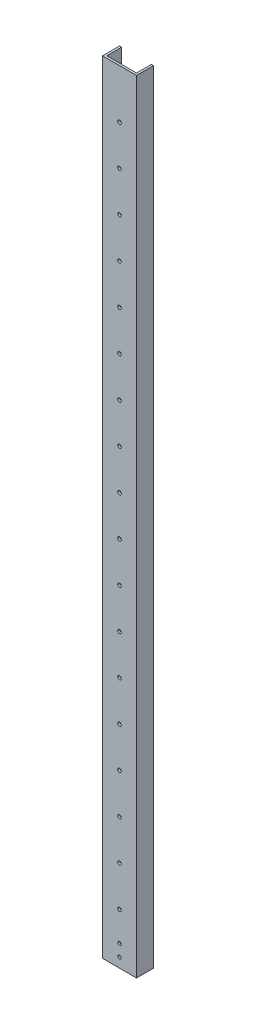
from build123d import *

# Parameters (mm, degrees)
BOSS_EXTRUDE1_DEPTH = 1168.4
CUT_EXTRUDE1_REACH  = 1171.78
SKETCH2_R           = 2.667
CUT_EXTRUDE2_REACH  = 1171.78
SKETCH3_R           = 2.5527
CUT_EXTRUDE3_REACH  = 1171.78
SKETCH4_R           = 2.667


with BuildPart() as part:
    # Sketch1 → Boss-Extrude1 (new body)
    with BuildSketch(Plane(origin=(0, 0, 0), x_dir=(1, 0, 0), z_dir=(0, 1, 0))):
        Polygon((3.175, 3.175), (3.175, 25.4), (0, 25.4), (0, 0), (50.8, 0), (50.8, 25.4), (47.625, 25.4), (47.625, 3.175), align=None)
    extrude(amount=BOSS_EXTRUDE1_DEPTH)

    # Sketch2 → Cut-Extrude1 (cut, up to next)
    with BuildSketch(Plane.XY, mode=Mode.PRIVATE) as cut_extrude1_sk1:
        with Locations((25.4, 76.2)):
            Circle(SKETCH2_R)
    cut_extrude1_tool1 = extrude(cut_extrude1_sk1.sketch, amount=-CUT_EXTRUDE1_REACH, mode=Mode.PRIVATE) & part.part
    # Sketch2 → Cut-Extrude1 (cut, up to next)
    with BuildSketch(Plane.XY, mode=Mode.PRIVATE) as cut_extrude1_sk2:
        with Locations((25.4, 136.144)):
            Circle(SKETCH2_R)
    cut_extrude1_tool2 = extrude(cut_extrude1_sk2.sketch, amount=-CUT_EXTRUDE1_REACH, mode=Mode.PRIVATE) & part.part
    # Sketch2 → Cut-Extrude1 (cut, up to next)
    with BuildSketch(Plane.XY, mode=Mode.PRIVATE) as cut_extrude1_sk3:
        with Locations((25.4, 196.088)):
            Circle(SKETCH2_R)
    cut_extrude1_tool3 = extrude(cut_extrude1_sk3.sketch, amount=-CUT_EXTRUDE1_REACH, mode=Mode.PRIVATE) & part.part
    # Sketch2 → Cut-Extrude1 (cut, up to next)
    with BuildSketch(Plane.XY, mode=Mode.PRIVATE) as cut_extrude1_sk4:
        with Locations((25.4, 256.032)):
            Circle(SKETCH2_R)
    cut_extrude1_tool4 = extrude(cut_extrude1_sk4.sketch, amount=-CUT_EXTRUDE1_REACH, mode=Mode.PRIVATE) & part.part
    # Sketch2 → Cut-Extrude1 (cut, up to next)
    with BuildSketch(Plane.XY, mode=Mode.PRIVATE) as cut_extrude1_sk5:
        with Locations((25.4, 315.976)):
            Circle(SKETCH2_R)
    cut_extrude1_tool5 = extrude(cut_extrude1_sk5.sketch, amount=-CUT_EXTRUDE1_REACH, mode=Mode.PRIVATE) & part.part
    # Sketch2 → Cut-Extrude1 (cut, up to next)
    with BuildSketch(Plane.XY, mode=Mode.PRIVATE) as cut_extrude1_sk6:
        with Locations((25.4, 375.92)):
            Circle(SKETCH2_R)
    cut_extrude1_tool6 = extrude(cut_extrude1_sk6.sketch, amount=-CUT_EXTRUDE1_REACH, mode=Mode.PRIVATE) & part.part
    # Sketch2 → Cut-Extrude1 (cut, up to next)
    with BuildSketch(Plane.XY, mode=Mode.PRIVATE) as cut_extrude1_sk7:
        with Locations((25.4, 435.864)):
            Circle(SKETCH2_R)
    cut_extrude1_tool7 = extrude(cut_extrude1_sk7.sketch, amount=-CUT_EXTRUDE1_REACH, mode=Mode.PRIVATE) & part.part
    # Sketch2 → Cut-Extrude1 (cut, up to next)
    with BuildSketch(Plane.XY, mode=Mode.PRIVATE) as cut_extrude1_sk8:
        with Locations((25.4, 495.808)):
            Circle(SKETCH2_R)
    cut_extrude1_tool8 = extrude(cut_extrude1_sk8.sketch, amount=-CUT_EXTRUDE1_REACH, mode=Mode.PRIVATE) & part.part
    # Sketch2 → Cut-Extrude1 (cut, up to next)
    with BuildSketch(Plane.XY, mode=Mode.PRIVATE) as cut_extrude1_sk9:
        with Locations((25.4, 555.752)):
            Circle(SKETCH2_R)
    cut_extrude1_tool9 = extrude(cut_extrude1_sk9.sketch, amount=-CUT_EXTRUDE1_REACH, mode=Mode.PRIVATE) & part.part
    # Sketch2 → Cut-Extrude1 (cut, up to next)
    with BuildSketch(Plane.XY, mode=Mode.PRIVATE) as cut_extrude1_sk10:
        with Locations((25.4, 615.696)):
            Circle(SKETCH2_R)
    cut_extrude1_tool10 = extrude(cut_extrude1_sk10.sketch, amount=-CUT_EXTRUDE1_REACH, mode=Mode.PRIVATE) & part.part
    # Sketch2 → Cut-Extrude1 (cut, up to next)
    with BuildSketch(Plane.XY, mode=Mode.PRIVATE) as cut_extrude1_sk11:
        with Locations((25.4, 675.64)):
            Circle(SKETCH2_R)
    cut_extrude1_tool11 = extrude(cut_extrude1_sk11.sketch, amount=-CUT_EXTRUDE1_REACH, mode=Mode.PRIVATE) & part.part
    # Sketch2 → Cut-Extrude1 (cut, up to next)
    with BuildSketch(Plane.XY, mode=Mode.PRIVATE) as cut_extrude1_sk12:
        with Locations((25.4, 735.584)):
            Circle(SKETCH2_R)
    cut_extrude1_tool12 = extrude(cut_extrude1_sk12.sketch, amount=-CUT_EXTRUDE1_REACH, mode=Mode.PRIVATE) & part.part
    # Sketch2 → Cut-Extrude1 (cut, up to next)
    with BuildSketch(Plane.XY, mode=Mode.PRIVATE) as cut_extrude1_sk13:
        with Locations((25.4, 795.528)):
            Circle(SKETCH2_R)
    cut_extrude1_tool13 = extrude(cut_extrude1_sk13.sketch, amount=-CUT_EXTRUDE1_REACH, mode=Mode.PRIVATE) & part.part
    # Sketch2 → Cut-Extrude1 (cut, up to next)
    with BuildSketch(Plane.XY, mode=Mode.PRIVATE) as cut_extrude1_sk14:
        with Locations((25.4, 855.472)):
            Circle(SKETCH2_R)
    cut_extrude1_tool14 = extrude(cut_extrude1_sk14.sketch, amount=-CUT_EXTRUDE1_REACH, mode=Mode.PRIVATE) & part.part
    # Sketch2 → Cut-Extrude1 (cut, up to next)
    with BuildSketch(Plane.XY, mode=Mode.PRIVATE) as cut_extrude1_sk15:
        with Locations((25.4, 915.416)):
            Circle(SKETCH2_R)
    cut_extrude1_tool15 = extrude(cut_extrude1_sk15.sketch, amount=-CUT_EXTRUDE1_REACH, mode=Mode.PRIVATE) & part.part
    # Sketch2 → Cut-Extrude1 (cut, up to next)
    with BuildSketch(Plane.XY, mode=Mode.PRIVATE) as cut_extrude1_sk16:
        with Locations((25.4, 975.36)):
            Circle(SKETCH2_R)
    cut_extrude1_tool16 = extrude(cut_extrude1_sk16.sketch, amount=-CUT_EXTRUDE1_REACH, mode=Mode.PRIVATE) & part.part
    # Sketch2 → Cut-Extrude1 (cut, up to next)
    with BuildSketch(Plane.XY, mode=Mode.PRIVATE) as cut_extrude1_sk17:
        with Locations((25.4, 1035.304)):
            Circle(SKETCH2_R)
    cut_extrude1_tool17 = extrude(cut_extrude1_sk17.sketch, amount=-CUT_EXTRUDE1_REACH, mode=Mode.PRIVATE) & part.part
    # Sketch2 → Cut-Extrude1 (cut, up to next)
    with BuildSketch(Plane.XY, mode=Mode.PRIVATE) as cut_extrude1_sk18:
        with Locations((25.4, 1095.248)):
            Circle(SKETCH2_R)
    cut_extrude1_tool18 = extrude(cut_extrude1_sk18.sketch, amount=-CUT_EXTRUDE1_REACH, mode=Mode.PRIVATE) & part.part
    add(cut_extrude1_tool1.solids().sort_by_distance((25.4, 76.2, 0))[0], mode=Mode.SUBTRACT)
    add(cut_extrude1_tool2.solids().sort_by_distance((25.4, 136.144, 0))[0], mode=Mode.SUBTRACT)
    add(cut_extrude1_tool3.solids().sort_by_distance((25.4, 196.088, 0))[0], mode=Mode.SUBTRACT)
    add(cut_extrude1_tool4.solids().sort_by_distance((25.4, 256.032, 0))[0], mode=Mode.SUBTRACT)
    add(cut_extrude1_tool5.solids().sort_by_distance((25.4, 315.976, 0))[0], mode=Mode.SUBTRACT)
    add(cut_extrude1_tool6.solids().sort_by_distance((25.4, 375.92, 0))[0], mode=Mode.SUBTRACT)
    add(cut_extrude1_tool7.solids().sort_by_distance((25.4, 435.864, 0))[0], mode=Mode.SUBTRACT)
    add(cut_extrude1_tool8.solids().sort_by_distance((25.4, 495.808, 0))[0], mode=Mode.SUBTRACT)
    add(cut_extrude1_tool9.solids().sort_by_distance((25.4, 555.752, 0))[0], mode=Mode.SUBTRACT)
    add(cut_extrude1_tool10.solids().sort_by_distance((25.4, 615.696, 0))[0], mode=Mode.SUBTRACT)
    add(cut_extrude1_tool11.solids().sort_by_distance((25.4, 675.64, 0))[0], mode=Mode.SUBTRACT)
    add(cut_extrude1_tool12.solids().sort_by_distance((25.4, 735.584, 0))[0], mode=Mode.SUBTRACT)
    add(cut_extrude1_tool13.solids().sort_by_distance((25.4, 795.528, 0))[0], mode=Mode.SUBTRACT)
    add(cut_extrude1_tool14.solids().sort_by_distance((25.4, 855.472, 0))[0], mode=Mode.SUBTRACT)
    add(cut_extrude1_tool15.solids().sort_by_distance((25.4, 915.416, 0))[0], mode=Mode.SUBTRACT)
    add(cut_extrude1_tool16.solids().sort_by_distance((25.4, 975.36, 0))[0], mode=Mode.SUBTRACT)
    add(cut_extrude1_tool17.solids().sort_by_distance((25.4, 1035.304, 0))[0], mode=Mode.SUBTRACT)
    add(cut_extrude1_tool18.solids().sort_by_distance((25.4, 1095.248, 0))[0], mode=Mode.SUBTRACT)

    # Sketch3 → Cut-Extrude2 (cut, up to next)
    with BuildSketch(Plane.XY, mode=Mode.PRIVATE) as cut_extrude2_sk1:
        with Locations((25.4, 32.131)):
            Circle(SKETCH3_R)
    cut_extrude2_tool1 = extrude(cut_extrude2_sk1.sketch, amount=-CUT_EXTRUDE2_REACH, mode=Mode.PRIVATE) & part.part
    # Sketch3 → Cut-Extrude2 (cut, up to next)
    with BuildSketch(Plane.XY, mode=Mode.PRIVATE) as cut_extrude2_sk2:
        with Locations((25.4, 14.2875)):
            Circle(SKETCH3_R)
    cut_extrude2_tool2 = extrude(cut_extrude2_sk2.sketch, amount=-CUT_EXTRUDE2_REACH, mode=Mode.PRIVATE) & part.part
    add(cut_extrude2_tool1.solids().sort_by_distance((25.4, 32.131, 0))[0], mode=Mode.SUBTRACT)
    add(cut_extrude2_tool2.solids().sort_by_distance((25.4, 14.2875, 0))[0], mode=Mode.SUBTRACT)

    # Sketch4 → Cut-Extrude3 (cut, up to next)
    with BuildSketch(Plane.ZY, mode=Mode.PRIVATE) as cut_extrude3_sk1:
        with Locations((-19.05, 76.2)):
            Circle(SKETCH4_R)
    cut_extrude3_tool1 = extrude(cut_extrude3_sk1.sketch, amount=-CUT_EXTRUDE3_REACH, mode=Mode.PRIVATE) & part.part
    # Sketch4 → Cut-Extrude3 (cut, up to next)
    with BuildSketch(Plane.ZY, mode=Mode.PRIVATE) as cut_extrude3_sk2:
        with Locations((-19.05, 136.144)):
            Circle(SKETCH4_R)
    cut_extrude3_tool2 = extrude(cut_extrude3_sk2.sketch, amount=-CUT_EXTRUDE3_REACH, mode=Mode.PRIVATE) & part.part
    # Sketch4 → Cut-Extrude3 (cut, up to next)
    with BuildSketch(Plane.ZY, mode=Mode.PRIVATE) as cut_extrude3_sk3:
        with Locations((-19.05, 196.088)):
            Circle(SKETCH4_R)
    cut_extrude3_tool3 = extrude(cut_extrude3_sk3.sketch, amount=-CUT_EXTRUDE3_REACH, mode=Mode.PRIVATE) & part.part
    # Sketch4 → Cut-Extrude3 (cut, up to next)
    with BuildSketch(Plane.ZY, mode=Mode.PRIVATE) as cut_extrude3_sk4:
        with Locations((-19.05, 256.032)):
            Circle(SKETCH4_R)
    cut_extrude3_tool4 = extrude(cut_extrude3_sk4.sketch, amount=-CUT_EXTRUDE3_REACH, mode=Mode.PRIVATE) & part.part
    # Sketch4 → Cut-Extrude3 (cut, up to next)
    with BuildSketch(Plane.ZY, mode=Mode.PRIVATE) as cut_extrude3_sk5:
        with Locations((-19.05, 315.976)):
            Circle(SKETCH4_R)
    cut_extrude3_tool5 = extrude(cut_extrude3_sk5.sketch, amount=-CUT_EXTRUDE3_REACH, mode=Mode.PRIVATE) & part.part
    # Sketch4 → Cut-Extrude3 (cut, up to next)
    with BuildSketch(Plane.ZY, mode=Mode.PRIVATE) as cut_extrude3_sk6:
        with Locations((-19.05, 375.92)):
            Circle(SKETCH4_R)
    cut_extrude3_tool6 = extrude(cut_extrude3_sk6.sketch, amount=-CUT_EXTRUDE3_REACH, mode=Mode.PRIVATE) & part.part
    # Sketch4 → Cut-Extrude3 (cut, up to next)
    with BuildSketch(Plane.ZY, mode=Mode.PRIVATE) as cut_extrude3_sk7:
        with Locations((-19.05, 435.864)):
            Circle(SKETCH4_R)
    cut_extrude3_tool7 = extrude(cut_extrude3_sk7.sketch, amount=-CUT_EXTRUDE3_REACH, mode=Mode.PRIVATE) & part.part
    # Sketch4 → Cut-Extrude3 (cut, up to next)
    with BuildSketch(Plane.ZY, mode=Mode.PRIVATE) as cut_extrude3_sk8:
        with Locations((-19.05, 495.808)):
            Circle(SKETCH4_R)
    cut_extrude3_tool8 = extrude(cut_extrude3_sk8.sketch, amount=-CUT_EXTRUDE3_REACH, mode=Mode.PRIVATE) & part.part
    # Sketch4 → Cut-Extrude3 (cut, up to next)
    with BuildSketch(Plane.ZY, mode=Mode.PRIVATE) as cut_extrude3_sk9:
        with Locations((-19.05, 555.752)):
            Circle(SKETCH4_R)
    cut_extrude3_tool9 = extrude(cut_extrude3_sk9.sketch, amount=-CUT_EXTRUDE3_REACH, mode=Mode.PRIVATE) & part.part
    # Sketch4 → Cut-Extrude3 (cut, up to next)
    with BuildSketch(Plane.ZY, mode=Mode.PRIVATE) as cut_extrude3_sk10:
        with Locations((-19.05, 615.696)):
            Circle(SKETCH4_R)
    cut_extrude3_tool10 = extrude(cut_extrude3_sk10.sketch, amount=-CUT_EXTRUDE3_REACH, mode=Mode.PRIVATE) & part.part
    # Sketch4 → Cut-Extrude3 (cut, up to next)
    with BuildSketch(Plane.ZY, mode=Mode.PRIVATE) as cut_extrude3_sk11:
        with Locations((-19.05, 675.64)):
            Circle(SKETCH4_R)
    cut_extrude3_tool11 = extrude(cut_extrude3_sk11.sketch, amount=-CUT_EXTRUDE3_REACH, mode=Mode.PRIVATE) & part.part
    # Sketch4 → Cut-Extrude3 (cut, up to next)
    with BuildSketch(Plane.ZY, mode=Mode.PRIVATE) as cut_extrude3_sk12:
        with Locations((-19.05, 735.584)):
            Circle(SKETCH4_R)
    cut_extrude3_tool12 = extrude(cut_extrude3_sk12.sketch, amount=-CUT_EXTRUDE3_REACH, mode=Mode.PRIVATE) & part.part
    # Sketch4 → Cut-Extrude3 (cut, up to next)
    with BuildSketch(Plane.ZY, mode=Mode.PRIVATE) as cut_extrude3_sk13:
        with Locations((-19.05, 795.528)):
            Circle(SKETCH4_R)
    cut_extrude3_tool13 = extrude(cut_extrude3_sk13.sketch, amount=-CUT_EXTRUDE3_REACH, mode=Mode.PRIVATE) & part.part
    # Sketch4 → Cut-Extrude3 (cut, up to next)
    with BuildSketch(Plane.ZY, mode=Mode.PRIVATE) as cut_extrude3_sk14:
        with Locations((-19.05, 855.472)):
            Circle(SKETCH4_R)
    cut_extrude3_tool14 = extrude(cut_extrude3_sk14.sketch, amount=-CUT_EXTRUDE3_REACH, mode=Mode.PRIVATE) & part.part
    # Sketch4 → Cut-Extrude3 (cut, up to next)
    with BuildSketch(Plane.ZY, mode=Mode.PRIVATE) as cut_extrude3_sk15:
        with Locations((-19.05, 915.416)):
            Circle(SKETCH4_R)
    cut_extrude3_tool15 = extrude(cut_extrude3_sk15.sketch, amount=-CUT_EXTRUDE3_REACH, mode=Mode.PRIVATE) & part.part
    # Sketch4 → Cut-Extrude3 (cut, up to next)
    with BuildSketch(Plane.ZY, mode=Mode.PRIVATE) as cut_extrude3_sk16:
        with Locations((-19.05, 975.36)):
            Circle(SKETCH4_R)
    cut_extrude3_tool16 = extrude(cut_extrude3_sk16.sketch, amount=-CUT_EXTRUDE3_REACH, mode=Mode.PRIVATE) & part.part
    # Sketch4 → Cut-Extrude3 (cut, up to next)
    with BuildSketch(Plane.ZY, mode=Mode.PRIVATE) as cut_extrude3_sk17:
        with Locations((-19.05, 1035.304)):
            Circle(SKETCH4_R)
    cut_extrude3_tool17 = extrude(cut_extrude3_sk17.sketch, amount=-CUT_EXTRUDE3_REACH, mode=Mode.PRIVATE) & part.part
    # Sketch4 → Cut-Extrude3 (cut, up to next)
    with BuildSketch(Plane.ZY, mode=Mode.PRIVATE) as cut_extrude3_sk18:
        with Locations((-19.05, 1095.248)):
            Circle(SKETCH4_R)
    cut_extrude3_tool18 = extrude(cut_extrude3_sk18.sketch, amount=-CUT_EXTRUDE3_REACH, mode=Mode.PRIVATE) & part.part
    add(cut_extrude3_tool1.solids().sort_by_distance((0, 76.2, -19.05))[0], mode=Mode.SUBTRACT)
    add(cut_extrude3_tool2.solids().sort_by_distance((0, 136.144, -19.05))[0], mode=Mode.SUBTRACT)
    add(cut_extrude3_tool3.solids().sort_by_distance((0, 196.088, -19.05))[0], mode=Mode.SUBTRACT)
    add(cut_extrude3_tool4.solids().sort_by_distance((0, 256.032, -19.05))[0], mode=Mode.SUBTRACT)
    add(cut_extrude3_tool5.solids().sort_by_distance((0, 315.976, -19.05))[0], mode=Mode.SUBTRACT)
    add(cut_extrude3_tool6.solids().sort_by_distance((0, 375.92, -19.05))[0], mode=Mode.SUBTRACT)
    add(cut_extrude3_tool7.solids().sort_by_distance((0, 435.864, -19.05))[0], mode=Mode.SUBTRACT)
    add(cut_extrude3_tool8.solids().sort_by_distance((0, 495.808, -19.05))[0], mode=Mode.SUBTRACT)
    add(cut_extrude3_tool9.solids().sort_by_distance((0, 555.752, -19.05))[0], mode=Mode.SUBTRACT)
    add(cut_extrude3_tool10.solids().sort_by_distance((0, 615.696, -19.05))[0], mode=Mode.SUBTRACT)
    add(cut_extrude3_tool11.solids().sort_by_distance((0, 675.64, -19.05))[0], mode=Mode.SUBTRACT)
    add(cut_extrude3_tool12.solids().sort_by_distance((0, 735.584, -19.05))[0], mode=Mode.SUBTRACT)
    add(cut_extrude3_tool13.solids().sort_by_distance((0, 795.528, -19.05))[0], mode=Mode.SUBTRACT)
    add(cut_extrude3_tool14.solids().sort_by_distance((0, 855.472, -19.05))[0], mode=Mode.SUBTRACT)
    add(cut_extrude3_tool15.solids().sort_by_distance((0, 915.416, -19.05))[0], mode=Mode.SUBTRACT)
    add(cut_extrude3_tool16.solids().sort_by_distance((0, 975.36, -19.05))[0], mode=Mode.SUBTRACT)
    add(cut_extrude3_tool17.solids().sort_by_distance((0, 1035.304, -19.05))[0], mode=Mode.SUBTRACT)
    add(cut_extrude3_tool18.solids().sort_by_distance((0, 1095.248, -19.05))[0], mode=Mode.SUBTRACT)


solid = part.part
